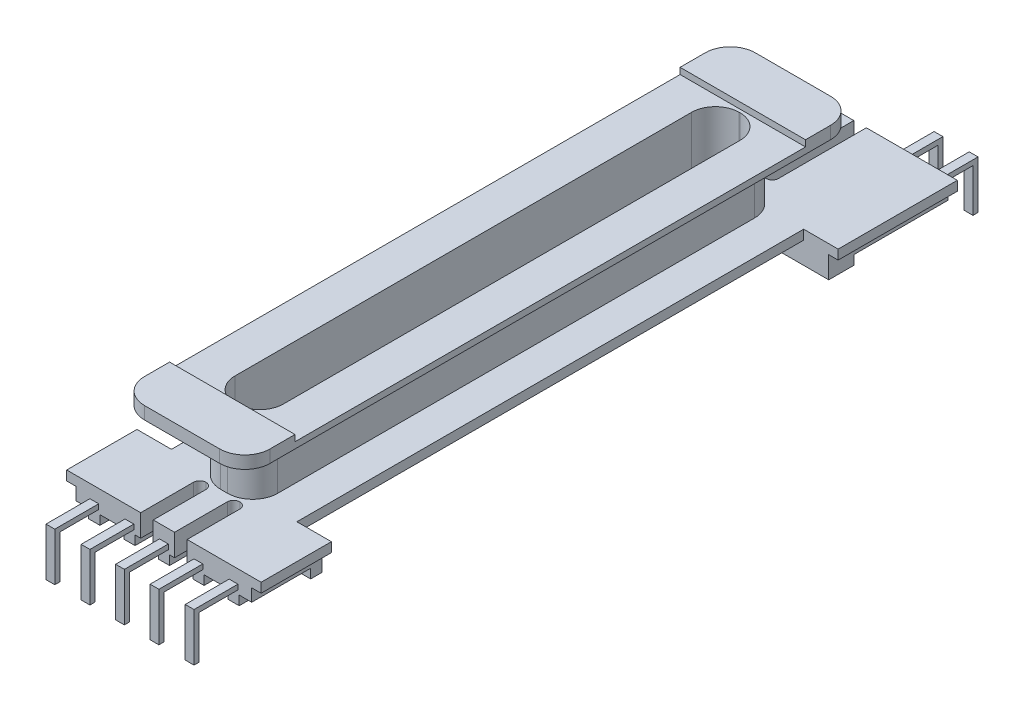
from build123d import *

# Parameters (mm, degrees)
EXTRUDE_1_DEPTH     = 0.76
SKETCH_2_W          = 14
SKETCH_2_H          = 9.5
SKETCH_2_H_2        = 5.6
EXTRUDE_2_DEPTH     = 1
SKETCH_3_W          = 14
SKETCH_3_H          = 2
SKETCH_3_W_2        = 0.9
SKETCH_3_H_2        = 5.9
SKETCH_3_H_3        = 2.8
SKETCH_3_H_4        = 1.4
SKETCH_3_H_5        = 0.9
SKETCH_3_H_6        = 3.2
SKETCH_3_H_7        = 0.7
EXTRUDE_3_DEPTH     = 0.74
SKETCH_4_W          = 1
SKETCH_4_H          = 9.031564953
SKETCH_4_H_2        = 5.71771085
CUT_EXTRUDE_1_DEPTH = 1.76
FILLET_1_R          = 0.5
EXTRUDE_4_DEPTH     = 5.1
EXTRUDE_5_DEPTH     = 0.5
EXTRUDE_6_DEPTH     = 0.5
CUT_EXTRUDE_2_DEPTH = 14.5
FILLET_2_R          = 0.5
SKETCH_9_W          = 0.7
SKETCH_9_H          = 0.4
EXTRUDE_7_DEPTH     = 3.5
SKETCH_10_W         = 0.7
SKETCH_10_H         = 0.4
EXTRUDE_8_DEPTH     = 3.5
SKETCH_11_W         = 0.7
SKETCH_11_H         = 0.4
EXTRUDE_9_DEPTH     = 3.44


with BuildPart() as part:
    # 草图1 → 凸台-拉伸1 (new body)
    with BuildSketch(Plane(origin=(0, 0, 0), x_dir=(1, 0, 0), z_dir=(0, 1, 0))):
        Polygon((15.5, 46), (15.5, 55.5), (0, 55.5), (0, 46), (2.75, 46), (2.75, 5.6), (0, 5.6), (0, 0), (15.5, 0), (15.5, 5.6), (12.75, 5.6), (12.75, 46), align=None)
    extrude(amount=EXTRUDE_1_DEPTH)

    # 草图2 → 凸台-拉伸2 (add)
    with BuildSketch(Plane.XZ):
        with Locations((7.75, -50.75)):
            Rectangle(SKETCH_2_W, SKETCH_2_H)
        with Locations((7.75, -2.8)):
            Rectangle(SKETCH_2_W, SKETCH_2_H_2)
    extrude(amount=EXTRUDE_2_DEPTH)

    # 草图3 → 凸台-拉伸3 (add)
    with BuildSketch(Plane.XZ.offset(1)):
        with Locations((7.75, -47)):
            Rectangle(SKETCH_3_W, SKETCH_3_H)
        with Locations((2.2, -52.55)):
            Rectangle(SKETCH_3_W_2, SKETCH_3_H_2)
        with Locations((5.95, -54.1)):
            Rectangle(SKETCH_3_W_2, SKETCH_3_H_3)
        with Locations((5.95, -50.3)):
            Rectangle(SKETCH_3_W_2, SKETCH_3_H_4)
        with Locations((9.55, -54.1)):
            Rectangle(SKETCH_3_W_2, SKETCH_3_H_3)
        with Locations((9.55, -50.3)):
            Rectangle(SKETCH_3_W_2, SKETCH_3_H_4)
        with Locations((13.3, -52.55)):
            Rectangle(SKETCH_3_W_2, SKETCH_3_H_2)
        with Locations((7.75, -5.15)):
            Rectangle(SKETCH_3_W, SKETCH_3_H_5)
        with Locations((2.2, -1.6)):
            Rectangle(SKETCH_3_W_2, SKETCH_3_H_6)
        with Locations((5, -1)):
            Rectangle(SKETCH_3_W_2, SKETCH_3_H)
        with Locations((5, -2.85)):
            Rectangle(SKETCH_3_W_2, SKETCH_3_H_7)
        with Locations((10.5, -1)):
            Rectangle(SKETCH_3_W_2, SKETCH_3_H)
        with Locations((10.5, -2.85)):
            Rectangle(SKETCH_3_W_2, SKETCH_3_H_7)
        with Locations((13.3, -1.6)):
            Rectangle(SKETCH_3_W_2, SKETCH_3_H_6)
        with Locations((7.75, -1)):
            Rectangle(SKETCH_3_W_2, SKETCH_3_H)
        with Locations((7.75, -2.85)):
            Rectangle(SKETCH_3_W_2, SKETCH_3_H_7)
    extrude(amount=EXTRUDE_3_DEPTH)

    # 草图4 → 切除-拉伸1 (cut)
    with BuildSketch(Plane.XZ.offset(1)):
        with Locations((7.75, -52.515782477)):
            Rectangle(SKETCH_4_W, SKETCH_4_H)
        with Locations((9.1, -1.841144575)):
            Rectangle(SKETCH_4_W, SKETCH_4_H_2)
        with Locations((6.4, -1.841144575)):
            Rectangle(SKETCH_4_W, SKETCH_4_H_2)
    extrude(amount=-CUT_EXTRUDE_1_DEPTH, mode=Mode.SUBTRACT)

    # 圆角1
    fillet_1_edges = [part.edges().sort_by_distance(p)[0] for p in [
        (8.25, -0.12, -48),
        (7.25, -0.12, -48),
    ]]
    fillet(fillet_1_edges, radius=FILLET_1_R - 0.0001)  # a hair under: the kernel refuses the full size

    # 草图5 → 凸台-拉伸4 (add)
    with BuildSketch(Plane(origin=(0, 0.76, 0), x_dir=(1, 0, 0), z_dir=(0, 1, 0))):
        with BuildLine():
            Line((8.025, 46.8), (7.475, 46.8))
            ThreePointArc((7.475, 46.8), (6.060786438, 46.214213562), (5.475, 44.8))
            Line((5.475, 44.8), (5.475, 6.8))
            ThreePointArc((5.475, 6.8), (6.060786438, 5.385786438), (7.475, 4.8))
            Line((7.475, 4.8), (8.025, 4.8))
            ThreePointArc((8.025, 4.8), (9.439213562, 5.385786438), (10.025, 6.8))
            Line((10.025, 6.8), (10.025, 44.8))
            ThreePointArc((10.025, 44.8), (9.439213562, 46.214213562), (8.025, 46.8))
        make_face()
    extrude(amount=EXTRUDE_4_DEPTH)

    # 草图6 → 凸台-拉伸5 (add)
    with BuildSketch(Plane(origin=(0, 5.86, 0), x_dir=(1, 0, 0), z_dir=(0, 1, 0))):
        with BuildLine():
            Line((4.75, 1.45), (10.75, 1.45))
            ThreePointArc((10.75, 1.45), (12.164213562, 2.035786438), (12.75, 3.45))
            Line((12.75, 3.45), (12.75, 48.15))
            ThreePointArc((12.75, 48.15), (12.164213562, 49.564213562), (10.75, 50.15))
            Line((10.75, 50.15), (4.75, 50.15))
            ThreePointArc((4.75, 50.15), (3.335786438, 49.564213562), (2.75, 48.15))
            Line((2.75, 48.15), (2.75, 3.45))
            ThreePointArc((2.75, 3.45), (3.335786438, 2.035786438), (4.75, 1.45))
        make_face()
    extrude(amount=EXTRUDE_5_DEPTH)

    # 草图7 → 凸台-拉伸6 (add)
    with BuildSketch(Plane(origin=(0, 6.36, 0), x_dir=(1, 0, 0), z_dir=(0, 1, 0))):
        with BuildLine():
            Line((2.75, 5.45), (12.75, 5.45))
            Line((12.75, 5.45), (12.75, 3.45))
            ThreePointArc((12.75, 3.45), (12.164213562, 2.035786438), (10.75, 1.45))
            Line((10.75, 1.45), (4.75, 1.45))
            ThreePointArc((4.75, 1.45), (3.335786438, 2.035786438), (2.75, 3.45))
            Line((2.75, 3.45), (2.75, 5.45))
        make_face()
        with BuildLine():
            Line((2.75, 46.15), (12.75, 46.15))
            Line((12.75, 46.15), (12.75, 48.15))
            ThreePointArc((12.75, 48.15), (12.164213562, 49.564213562), (10.75, 50.15))
            Line((10.75, 50.15), (4.75, 50.15))
            ThreePointArc((4.75, 50.15), (3.335786438, 49.564213562), (2.75, 48.15))
            Line((2.75, 48.15), (2.75, 46.15))
        make_face()
    extrude(amount=EXTRUDE_6_DEPTH)

    # 草图8 → 切除-拉伸2 (cut)
    with BuildSketch(Plane(origin=(0, 6.36, 0), x_dir=(1, 0, 0), z_dir=(0, 1, 0))):
        with BuildLine():
            Line((7.715, 5.7), (7.785, 5.7))
            ThreePointArc((7.785, 5.7), (9.128502884, 6.256497116), (9.685, 7.6))
            Line((9.685, 7.6), (9.685, 44))
            ThreePointArc((9.685, 44), (9.128502884, 45.343502884), (7.785, 45.9))
            Line((7.785, 45.9), (7.715, 45.9))
            ThreePointArc((7.715, 45.9), (6.371497116, 45.343502884), (5.815, 44))
            Line((5.815, 44), (5.815, 7.6))
            ThreePointArc((5.815, 7.6), (6.371497116, 6.256497116), (7.715, 5.7))
        make_face()
    extrude(amount=-CUT_EXTRUDE_2_DEPTH, mode=Mode.SUBTRACT)

    # 圆角2
    fillet_2_edges = [part.edges().sort_by_distance(p)[0] for p in [
        (9.6, -0.12, -4.7),
        (8.6, -0.12, -4.7),
        (5.9, -0.12, -4.7),
        (6.9, -0.12, -4.7),
    ]]
    fillet(fillet_2_edges, radius=FILLET_2_R - 0.0001)  # a hair under: the kernel refuses the full size

    # 草图9 → 凸台-拉伸7 (add)
    with BuildSketch(Plane.XY):
        with Locations((13.3, -0.5)):
            Rectangle(SKETCH_9_W, SKETCH_9_H)
        with Locations((10.5, -0.5)):
            Rectangle(SKETCH_9_W, SKETCH_9_H)
        with Locations((7.75, -0.5)):
            Rectangle(SKETCH_9_W, SKETCH_9_H)
        with Locations((5, -0.5)):
            Rectangle(SKETCH_9_W, SKETCH_9_H)
        with Locations((2.2, -0.5)):
            Rectangle(SKETCH_9_W, SKETCH_9_H)
    extrude(amount=EXTRUDE_7_DEPTH)

    # 草图10 → 凸台-拉伸8 (add)
    with BuildSketch(Plane(origin=(0, 0, -55.5), x_dir=(-1, 0, 0), z_dir=(0, 0, -1))):
        with Locations((-10.5, -0.5)):
            Rectangle(SKETCH_10_W, SKETCH_10_H)
        with Locations((-13.3, -0.5)):
            Rectangle(SKETCH_10_W, SKETCH_10_H)
    extrude(amount=EXTRUDE_8_DEPTH)

    # 草图11 → 凸台-拉伸9 (add)
    with BuildSketch(Plane.XZ.offset(0.7)):
        with Locations((10.5, -58.8)):
            Rectangle(SKETCH_11_W, SKETCH_11_H)
        with Locations((13.3, -58.8)):
            Rectangle(SKETCH_11_W, SKETCH_11_H)
        with Locations((13.3, 3.3)):
            Rectangle(SKETCH_11_W, SKETCH_11_H)
        with Locations((10.5, 3.3)):
            Rectangle(SKETCH_11_W, SKETCH_11_H)
        with Locations((7.75, 3.3)):
            Rectangle(SKETCH_11_W, SKETCH_11_H)
        with Locations((5, 3.3)):
            Rectangle(SKETCH_11_W, SKETCH_11_H)
        with Locations((2.2, 3.3)):
            Rectangle(SKETCH_11_W, SKETCH_11_H)
    extrude(amount=EXTRUDE_9_DEPTH)


solid = part.part
